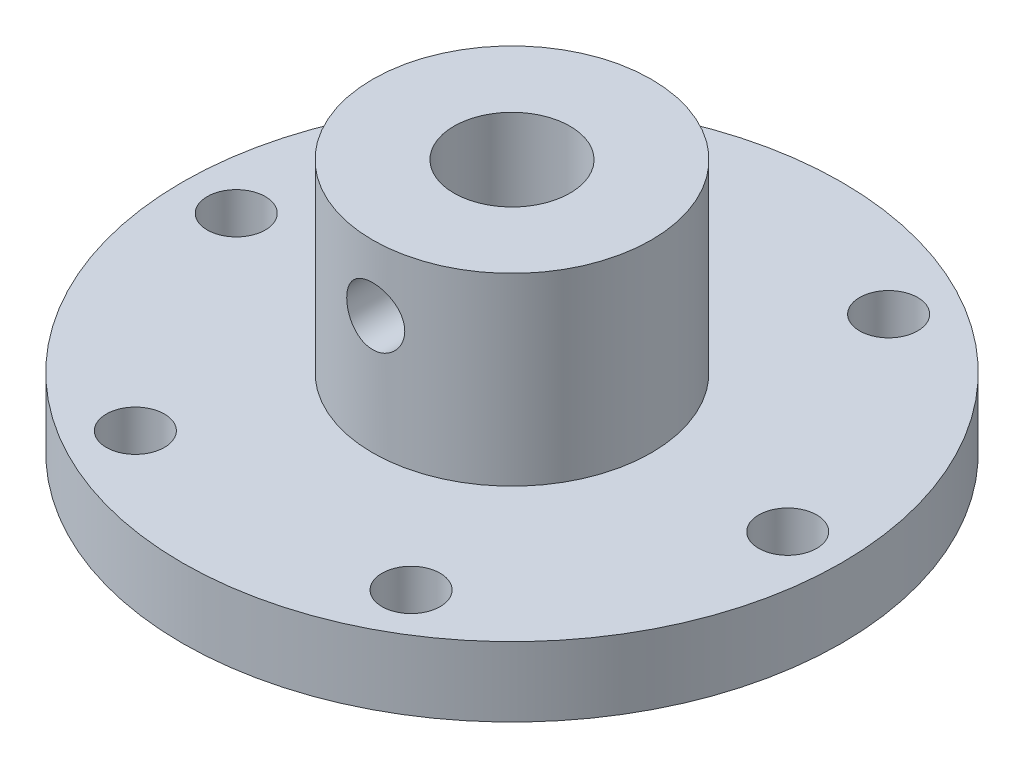
from build123d import *

# Parameters (mm, degrees)
SKETCH1_R           = 28.4
BOSS_EXTRUDE1_DEPTH = 6
SKETCH2_R           = 12
BOSS_EXTRUDE2_DEPTH = 15.875
SKETCH3_R           = 5
CUT_EXTRUDE1_DEPTH  = 46.734403079
SKETCH7_W           = 2.5
SKETCH7_H           = 28.4
M6_TAPPED_HOLE1_D   = 5


with BuildPart() as part:
    # Sketch1 → Boss-Extrude1 (new body)
    with BuildSketch(Plane(origin=(0, 0, 0), x_dir=(1, 0, 0), z_dir=(0, 1, 0))):
        Circle(SKETCH1_R)
    extrude(amount=BOSS_EXTRUDE1_DEPTH)

    # Sketch2 → Boss-Extrude2 (add)
    with BuildSketch(Plane(origin=(0, 6, 0), x_dir=(1, 0, 0), z_dir=(0, 1, 0))):
        Circle(SKETCH2_R)
    extrude(amount=BOSS_EXTRUDE2_DEPTH)

    # Sketch3 → Cut-Extrude1 (cut, through all)
    with BuildSketch(Plane(origin=(0, 21.875, 0), x_dir=(1, 0, 0), z_dir=(0, 1, 0))):
        Circle(SKETCH3_R)
    extrude(amount=-CUT_EXTRUDE1_DEPTH, mode=Mode.SUBTRACT)

    # Sketch7 → M6x1.0 Tapped Hole1 (revolve, cut)
    with BuildSketch(Plane(origin=(0, 16.2, 0), x_dir=(0, 1, 0), z_dir=(1, 0, 0))):
        with Locations((1.25, 14.2)):
            Rectangle(SKETCH7_W, SKETCH7_H)
    revolve(axis=Axis((0, 16.2, -6.35), (0, 0, 1)), mode=Mode.SUBTRACT)

    # M6 Tapped Hole1 (through all)
    with Locations(Plane(origin=(0, 0, 0), x_dir=(-1, 0, 0), z_dir=(0, -1, 0))):
        with Locations((23.75, 0), (11.875, -20.56810334), (-11.875, -20.56810334), (-23.75, 0), (-11.875, 20.56810334), (11.875, 20.56810334)):
            Hole(M6_TAPPED_HOLE1_D / 2)


solid = part.part
